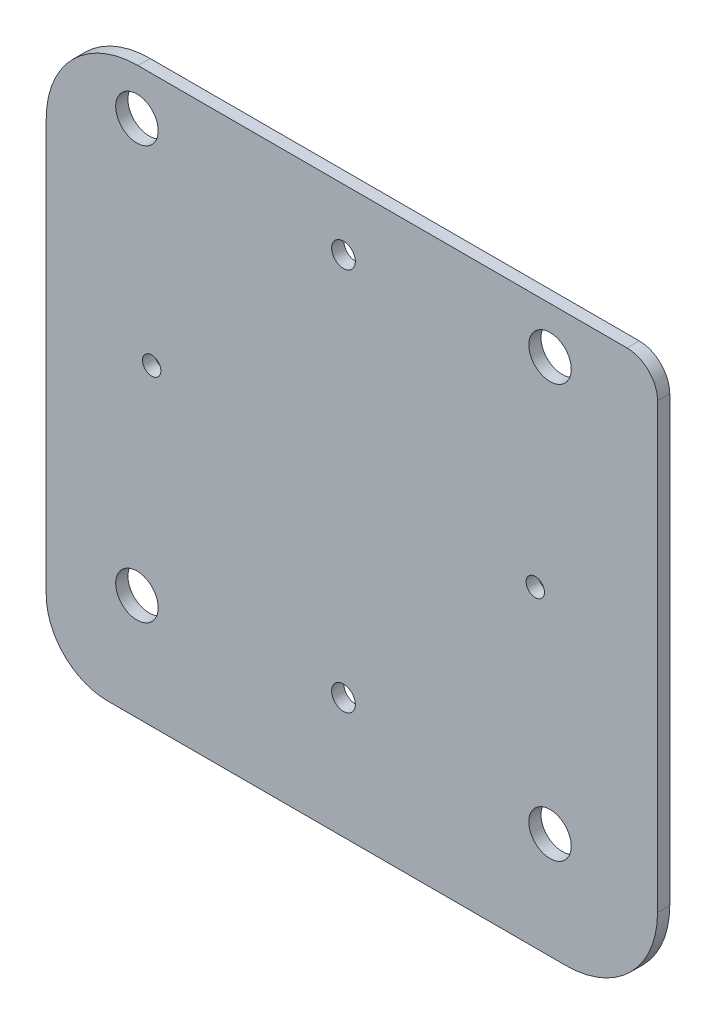
from build123d import *

# Parameters (mm, degrees)
BOSS_EXTRUDE1_DEPTH       = 1.6
CUT_EXTRUDE3_REACH        = 60.005
SKETCH3_R                 = 1.55
SKETCH3_R_2               = 1.2
CUT_EXTRUDE4_REACH        = 60.005
PRESS_FIT_NUT_LOCATIONS_R = 2.78


with BuildPart() as part:
    # Outline → Boss-Extrude1 (new body)
    with BuildSketch(Plane.XY):
        with BuildLine():
            Line((-38.9, 21.1), (-38.9, -32.9))
            ThreePointArc((-38.9, -32.9), (-36.556854249, -38.556854249), (-30.9, -40.9))
            Line((-30.9, -40.9), (29.1, -40.9))
            ThreePointArc((29.1, -40.9), (37.585281374, -37.385281374), (41.1, -28.9))
            Line((41.1, -28.9), (41.1, 29.1))
            ThreePointArc((41.1, 29.1), (39.928427125, 31.928427125), (37.1, 33.1))
            Line((37.1, 33.1), (-26.9, 33.1))
            ThreePointArc((-26.9, 33.1), (-35.385281374, 29.585281374), (-38.9, 21.1))
        make_face()
    extrude(amount=BOSS_EXTRUDE1_DEPTH)

    # Sketch3 → Cut-Extrude3 (cut, up to next)
    with BuildSketch(Plane.XY.offset(1.6), mode=Mode.PRIVATE) as cut_extrude3_sk1:
        with Locations((-6.677e-06, 25.099991446)):
            Circle(SKETCH3_R)
    cut_extrude3_tool1 = extrude(cut_extrude3_sk1.sketch, amount=-CUT_EXTRUDE3_REACH, mode=Mode.PRIVATE) & part.part
    # Sketch3 → Cut-Extrude3 (cut, up to next)
    with BuildSketch(Plane.XY.offset(1.6), mode=Mode.PRIVATE) as cut_extrude3_sk2:
        with Locations((25.099993323, -8.554e-06)):
            Circle(SKETCH3_R_2)
    cut_extrude3_tool2 = extrude(cut_extrude3_sk2.sketch, amount=-CUT_EXTRUDE3_REACH, mode=Mode.PRIVATE) & part.part
    # Sketch3 → Cut-Extrude3 (cut, up to next)
    with BuildSketch(Plane.XY.offset(1.6), mode=Mode.PRIVATE) as cut_extrude3_sk3:
        with Locations((-6.677e-06, -25.100008554)):
            Circle(SKETCH3_R)
    cut_extrude3_tool3 = extrude(cut_extrude3_sk3.sketch, amount=-CUT_EXTRUDE3_REACH, mode=Mode.PRIVATE) & part.part
    # Sketch3 → Cut-Extrude3 (cut, up to next)
    with BuildSketch(Plane.XY.offset(1.6), mode=Mode.PRIVATE) as cut_extrude3_sk4:
        with Locations((-25.100006677, -8.554e-06)):
            Circle(SKETCH3_R_2)
    cut_extrude3_tool4 = extrude(cut_extrude3_sk4.sketch, amount=-CUT_EXTRUDE3_REACH, mode=Mode.PRIVATE) & part.part
    add(cut_extrude3_tool1.solids().sort_by_distance((-7e-06, 25.099991, 1.6))[0], mode=Mode.SUBTRACT)
    add(cut_extrude3_tool2.solids().sort_by_distance((25.099993, -9e-06, 1.6))[0], mode=Mode.SUBTRACT)
    add(cut_extrude3_tool3.solids().sort_by_distance((-7e-06, -25.100009, 1.6))[0], mode=Mode.SUBTRACT)
    add(cut_extrude3_tool4.solids().sort_by_distance((-25.100007, -9e-06, 1.6))[0], mode=Mode.SUBTRACT)

    # Press Fit Nut Locations → Cut-Extrude4 (cut, up to next)
    with BuildSketch(Plane.XY.offset(1.6), mode=Mode.PRIVATE) as cut_extrude4_sk1:
        with Locations((-27.030733336, 27.030733336)):
            Circle(PRESS_FIT_NUT_LOCATIONS_R)
    cut_extrude4_tool1 = extrude(cut_extrude4_sk1.sketch, amount=-CUT_EXTRUDE4_REACH, mode=Mode.PRIVATE) & part.part
    # Press Fit Nut Locations → Cut-Extrude4 (cut, up to next)
    with BuildSketch(Plane.XY.offset(1.6), mode=Mode.PRIVATE) as cut_extrude4_sk2:
        with Locations((27.030733336, 27.030733336)):
            Circle(PRESS_FIT_NUT_LOCATIONS_R)
    cut_extrude4_tool2 = extrude(cut_extrude4_sk2.sketch, amount=-CUT_EXTRUDE4_REACH, mode=Mode.PRIVATE) & part.part
    # Press Fit Nut Locations → Cut-Extrude4 (cut, up to next)
    with BuildSketch(Plane.XY.offset(1.6), mode=Mode.PRIVATE) as cut_extrude4_sk3:
        with Locations((-27.030733336, -27.030733336)):
            Circle(PRESS_FIT_NUT_LOCATIONS_R)
    cut_extrude4_tool3 = extrude(cut_extrude4_sk3.sketch, amount=-CUT_EXTRUDE4_REACH, mode=Mode.PRIVATE) & part.part
    # Press Fit Nut Locations → Cut-Extrude4 (cut, up to next)
    with BuildSketch(Plane.XY.offset(1.6), mode=Mode.PRIVATE) as cut_extrude4_sk4:
        with Locations((27.030733336, -27.030733336)):
            Circle(PRESS_FIT_NUT_LOCATIONS_R)
    cut_extrude4_tool4 = extrude(cut_extrude4_sk4.sketch, amount=-CUT_EXTRUDE4_REACH, mode=Mode.PRIVATE) & part.part
    add(cut_extrude4_tool1.solids().sort_by_distance((-27.030733, 27.030733, 1.6))[0], mode=Mode.SUBTRACT)
    add(cut_extrude4_tool2.solids().sort_by_distance((27.030733, 27.030733, 1.6))[0], mode=Mode.SUBTRACT)
    add(cut_extrude4_tool3.solids().sort_by_distance((-27.030733, -27.030733, 1.6))[0], mode=Mode.SUBTRACT)
    add(cut_extrude4_tool4.solids().sort_by_distance((27.030733, -27.030733, 1.6))[0], mode=Mode.SUBTRACT)


solid = part.part
